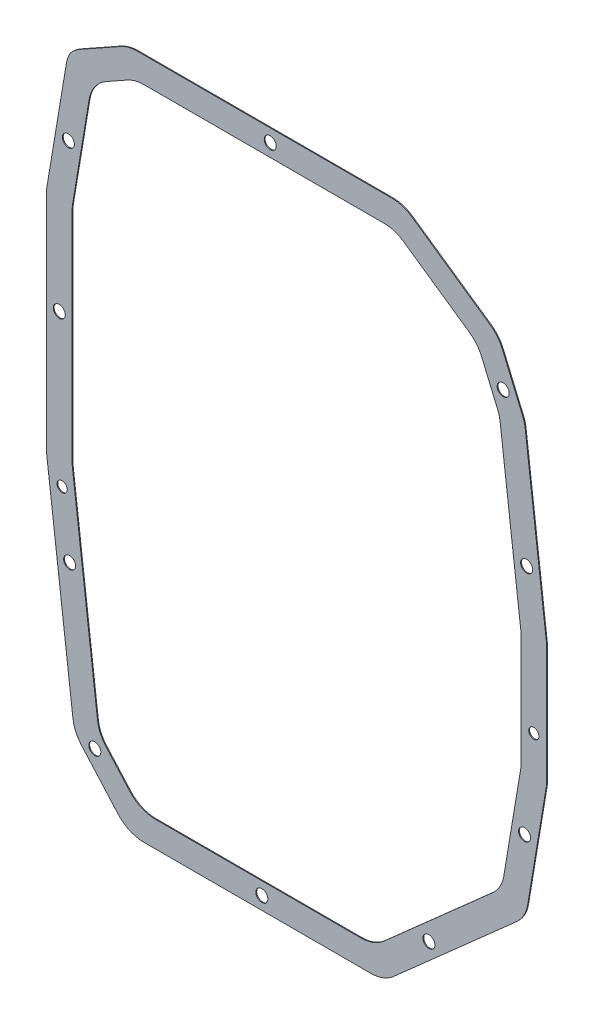
from build123d import *

# Parameters (mm, degrees)
ESTRUSIONE_ESTRUSIONE1_DEPTH         = 77
SCHIZZO2_R                           = 50
SCHIZZO2_R_2                         = 36
SCHIZZO2_R_3                         = 26
TAGLIO_ESTRUSIONE1_DEPTH             = 485.526998211
TAGLIO_ESTRUSIONE2_DEPTH             = 48
FORO_FILETTATO_M8_1_D                = 6.8
FORO_FILETTATO_M8_1_DEPTH            = 23
FORO_FILETTATO_M8_1_CSINK_D          = 8.05
FORO_FILETTATO_M8_1_CSINK_ANGLE      = 90
FORO_FILETTATO_M8_1_TIP              = 2.042926105
SCHIZZO10_R                          = 3.5
TAGLIO_ESTRUSIONE3_DEPTH             = 485.526998211
RACCORDO1_R                          = 20
RACCORDO2_R                          = 2
ESTRUSIONE_ESTRUSIONE2_START         = -4.5
SCHIZZO11_R                          = 50
SCHIZZO11_R_2                        = 43
ESTRUSIONE_ESTRUSIONE2_DEPTH         = 4.5
ESTRUSIONE_ESTRUSIONE4_START         = 5
SCHIZZO12_R                          = 33.5
ESTRUSIONE_ESTRUSIONE4_DEPTH         = 6
ESTRUSIONE_ESTRUSIONE5_START         = -4
SCHIZZO13_R                          = 26
SCHIZZO13_R_2                        = 23
ESTRUSIONE_ESTRUSIONE5_DEPTH         = 4
SCHIZZO15_R                          = 3
TAGLIO_ESTRUSIONE4_DEPTH             = 11
RACCORDO4_R                          = 20
FORO_FILETTATO_M20X1_5_1_D           = 18.5
FORO_FILETTATO_M20X1_5_1_DEPTH       = 44.5
FORO_FILETTATO_M20X1_5_1_CSINK_D     = 20.05
FORO_FILETTATO_M20X1_5_1_CSINK_ANGLE = 90
FORO_FILETTATO_M20X1_5_1_TIP         = 5.557960726
FORO_FILETTATO_G1_2_1_D              = 19
FORO_FILETTATO_G1_2_1_DEPTH          = 15
FORO_FILETTATO_G1_2_1_CSINK_D        = 21.005
FORO_FILETTATO_G1_2_1_CSINK_ANGLE    = 90
FORO_FILETTATO_M20X1_5_3_D           = 18.5
FORO_FILETTATO_M20X1_5_3_CSINK_D     = 20.05
FORO_FILETTATO_M20X1_5_3_CSINK_ANGLE = 90
RACCORDO6_R                          = 4
SCHIZZO24_W                          = 424.699843927
SCHIZZO24_H                          = 472.863672624
TAGLIO_ESTRUSIONE8_DEPTH             = 76.5


with BuildPart() as part:
    # Schizzo1 → Estrusione-Estrusione1 (new body)
    with BuildSketch(Plane.XY):
        Polygon((59.972038663, -9.548657155), (184.107415497, -9.548657155), (266.906928499, 63.824268584), (279.182675389, 137.377787042), (279.182675389, 207.628992193), (266.264112981, 313.83800459), (251.001397802, 349.730658864), (195.196318474, 388.451342845), (34.975107006, 388.451342845), (2.569160579, 370.255254654), (-0.4487972, 365.905709245), (-12.817324611, 291.796270746), (-12.817324611, 270.140647245), (-12.817324611, 159.542730711), (-8.096788353, 120.733188436), (-1.277749696, 64.670962751), (3.418345685, 26.062359347), (34.975107006, -9.548657155), align=None)
    extrude(amount=ESTRUSIONE_ESTRUSIONE1_DEPTH)

    # Schizzo2 → Taglio-Estrusione1 (cut, through all)
    with BuildSketch(Plane.XY.offset(77)):
        with Locations((119.182675389, 251.951342845)):
            Circle(SCHIZZO2_R)
        with Locations((227.185755277, 174.346140283)):
            Circle(SCHIZZO2_R_2)
        with Locations((119.182675389, 109.451342845)):
            Circle(SCHIZZO2_R_3)
    extrude(amount=-TAGLIO_ESTRUSIONE1_DEPTH, mode=Mode.SUBTRACT)

    # Schizzo4 → Taglio-Estrusione2 (cut)
    with BuildSketch(Plane(origin=(0, 0, 0), x_dir=(-1, 0, 0), z_dir=(0, 0, -1))):
        Polygon((-190.502060744, 373.451342845), (-238.892279388, 339.875503756), (-251.63003789, 309.920678761), (-264.182675389, 206.720091138), (-264.182675389, 138.620905818), (-252.98547965, 71.529823638), (-178.417565472, 5.451342845), (-41.724902169, 5.451342845), (-17.744303444, 32.512849195), (-2.182675389, 160.451631766), (-2.182675389, 290.55315197), (-13.652120373, 359.275490486), (-38.898311054, 373.451342845), align=None)
    extrude(amount=-TAGLIO_ESTRUSIONE2_DEPTH, mode=Mode.SUBTRACT)

    # Foro filettato M8-1
    with Locations(Plane(origin=(119.182675389, 309.951342845, 77), x_dir=(1, 0, 0), z_dir=(0, 0, 1))):
        with Locations((0, 0), (-50.22947342, -87), (50.229473419, -87), (63.003079888, -135.605202562), (130.503079888, -96.634059392), (130.503079888, -174.576345732), (0, -165.5), (-30.310889133, -218), (30.310889132, -218)):
            CounterSinkHole(FORO_FILETTATO_M8_1_D / 2, FORO_FILETTATO_M8_1_CSINK_D / 2, depth=FORO_FILETTATO_M8_1_DEPTH, counter_sink_angle=FORO_FILETTATO_M8_1_CSINK_ANGLE)
            with Locations((0, 0, -(FORO_FILETTATO_M8_1_DEPTH + FORO_FILETTATO_M8_1_TIP / 2))):  # 118° drill point
                Cone(0, FORO_FILETTATO_M8_1_D / 2, FORO_FILETTATO_M8_1_TIP, mode=Mode.SUBTRACT)

    # Schizzo10 → Taglio-Estrusione3 (cut, through all)
    with BuildSketch(Plane(origin=(0, 0, 0), x_dir=(-1, 0, 0), z_dir=(0, 0, -1))):
        with Locations((-117.807073551, 380.951342845)):
            Circle(SCHIZZO10_R)
        with Locations((-253.771981004, 324.049383053)):
            Circle(SCHIZZO10_R)
        with Locations((5.317324611, 234.131684501)):
            Circle(SCHIZZO10_R)
        with Locations((-266.254748996, 105.476430494)):
            Circle(SCHIZZO10_R)
        with Locations((-0.739238535, 110.203591991)):
            Circle(SCHIZZO10_R)
        with Locations((-112.919102804, -2.048657155)):
            Circle(SCHIZZO10_R)
        with Locations((0.002847066, 323.017867274)):
            Circle(SCHIZZO10_R)
        with Locations((-267.481177866, 241.716845092)):
            Circle(SCHIZZO10_R)
        with Locations((-210.419102804, 23.451342845)):
            Circle(SCHIZZO10_R)
        with Locations((-15.419102804, 23.451342845)):
            Circle(SCHIZZO10_R)
    extrude(amount=-TAGLIO_ESTRUSIONE3_DEPTH, mode=Mode.SUBTRACT)

    # Raccordo1
    # the kernel refuses this fillet: 20 mm, written as the material it takes off along each edge
    with BuildSketch(Plane(origin=(34.975107006, 388.451342845, -13.077346825), x_dir=(1, 0, 0), z_dir=(0, 0, 1))) as raccordo1_piece_1:
        with BuildLine():
            CenterArc((RACCORDO1_R * 0.261546936495, -RACCORDO1_R), RACCORDO1_R, 90, 29.314411212)
            Line((-RACCORDO1_R * 0.228054845331, -RACCORDO1_R * 0.128053846139), (0, 0))
            Line((0, 0), (RACCORDO1_R * 0.261546936495, 0))
        make_face()
    extrude(amount=103.15469365, mode=Mode.SUBTRACT)
    with BuildSketch(Plane(origin=(2.569160579, 370.255254654, -11.511478705), x_dir=(-0.5700695452044089, -0.821596442075085, 0), z_dir=(0, 0, 1))) as raccordo1_piece_2:
        with BuildLine():
            CenterArc((RACCORDO1_R * 0.230229574105, RACCORDO1_R), RACCORDO1_R, 244.069486706, 25.930513294)
            Line((-RACCORDO1_R * 0.207051218491, RACCORDO1_R * 0.100674970644), (0, 0))
            Line((0, 0), (RACCORDO1_R * 0.230229574105, 0))
        make_face()
    extrude(amount=100.022957411, mode=Mode.SUBTRACT)
    with BuildSketch(Plane(origin=(-0.4487972, 365.905709245, -11.212980636), x_dir=(-0.1646185376039717, -0.9863573070024523, 0), z_dir=(0, 0, 1))) as raccordo1_piece_3:
        with BuildLine():
            CenterArc((RACCORDO1_R * 0.224259612729, RACCORDO1_R), RACCORDO1_R, 244.719999772, 25.280000228)
            Line((-RACCORDO1_R * 0.202782643888, RACCORDO1_R * 0.0957683310879), (0, 0))
            Line((0, 0), (RACCORDO1_R * 0.224259612729, 0))
        make_face()
    extrude(amount=99.425961273, mode=Mode.SUBTRACT)
    with BuildSketch(Plane(origin=(-12.817324611, 291.796270746, -4.143729253), x_dir=(0, -1, 0), z_dir=(0, 0, 1))) as raccordo1_piece_4:
        with BuildLine():
            CenterArc((RACCORDO1_R * 0.0828745850626, RACCORDO1_R), RACCORDO1_R, 260.524924734, 9.475075266)
            Line((-RACCORDO1_R * 0.0817439525413, RACCORDO1_R * 0.0136426929975), (0, 0))
            Line((0, 0), (RACCORDO1_R * 0.0828745850626, 0))
        make_face()
    extrude(amount=85.287458506, mode=Mode.SUBTRACT)
    with BuildSketch(Plane(origin=(-12.817324611, 159.542730711, -3.029670184), x_dir=(0.12074349030746913, -0.9926837409509486, 0), z_dir=(0, 0, 1))) as raccordo1_piece_5:
        with BuildLine():
            CenterArc((RACCORDO1_R * 0.0605934036727, RACCORDO1_R), RACCORDO1_R, 263.064986553, 6.935013447)
            Line((-RACCORDO1_R * 0.0601500866348, RACCORDO1_R * 0.00731625904905), (0, 0))
            Line((0, 0), (RACCORDO1_R * 0.0605934036727, 0))
        make_face()
    extrude(amount=83.059340367, mode=Mode.SUBTRACT)
    with BuildSketch(Plane(origin=(3.418345685, 26.062359347, -15.578434173), x_dir=(0.6632186619985212, -0.7484256852733552, 0), z_dir=(0, 0, 1))) as raccordo1_piece_6:
        with BuildLine():
            CenterArc((RACCORDO1_R * 0.311568683461, RACCORDO1_R), RACCORDO1_R, 235.389202752, 34.610797248)
            Line((-RACCORDO1_R * 0.256430169524, RACCORDO1_R * 0.176970654832), (0, 0))
            Line((0, 0), (RACCORDO1_R * 0.311568683461, 0))
        make_face()
    extrude(amount=108.156868346, mode=Mode.SUBTRACT)
    with BuildSketch(Plane(origin=(34.975107006, -9.548657155, -22.499317209), x_dir=(1, 0, 0), z_dir=(0, 0, 1))) as raccordo1_piece_7:
        with BuildLine():
            CenterArc((RACCORDO1_R * 0.449986344173, RACCORDO1_R), RACCORDO1_R, 221.545810695, 48.454189305)
            Line((-RACCORDO1_R * 0.2984393411, RACCORDO1_R * 0.336781338001), (0, 0))
            Line((0, 0), (RACCORDO1_R * 0.449986344173, 0))
        make_face()
    extrude(amount=121.998634417, mode=Mode.SUBTRACT)
    with BuildSketch(Plane(origin=(184.107415497, -9.548657155, -18.966166752), x_dir=(-1, 0, 0), z_dir=(0, 0, 1))) as raccordo1_piece_8:
        with BuildLine():
            CenterArc((RACCORDO1_R * 0.379323335035, -RACCORDO1_R), RACCORDO1_R, 90, 41.545810695)
            Line((-RACCORDO1_R * 0.283895326964, -RACCORDO1_R * 0.251574314727), (0, 0))
            Line((0, 0), (RACCORDO1_R * 0.379323335035, 0))
        make_face()
    extrude(amount=114.932333503, mode=Mode.SUBTRACT)
    with BuildSketch(Plane(origin=(266.906928499, 63.824268584, -17.695673271), x_dir=(-0.7484256852733557, -0.6632186619985205, 0), z_dir=(0, 0, 1))) as raccordo1_piece_9:
        with BuildLine():
            CenterArc((RACCORDO1_R * 0.353913465424, -RACCORDO1_R), RACCORDO1_R, 90, 38.979114039)
            Line((-RACCORDO1_R * 0.275123591744, -RACCORDO1_R * 0.222624684782), (0, 0))
            Line((0, 0), (RACCORDO1_R * 0.353913465424, 0))
        make_face()
    extrude(amount=112.391346542, mode=Mode.SUBTRACT)
    with BuildSketch(Plane(origin=(279.182675389, 137.377787042, -4.143729253), x_dir=(-0.1646185376039625, -0.9863573070024537, 0), z_dir=(0, 0, 1))) as raccordo1_piece_10:
        with BuildLine():
            CenterArc((RACCORDO1_R * 0.0828745850626, -RACCORDO1_R), RACCORDO1_R, 90, 9.475075266)
            Line((-RACCORDO1_R * 0.0817439525413, -RACCORDO1_R * 0.0136426929975), (0, 0))
            Line((0, 0), (RACCORDO1_R * 0.0828745850626, 0))
        make_face()
    extrude(amount=85.287458506, mode=Mode.SUBTRACT)
    with BuildSketch(Plane(origin=(279.182675389, 207.628992193, -3.029670184), x_dir=(0, -1, 0), z_dir=(0, 0, 1))) as raccordo1_piece_11:
        with BuildLine():
            CenterArc((RACCORDO1_R * 0.0605934036727, -RACCORDO1_R), RACCORDO1_R, 90, 6.935013447)
            Line((-RACCORDO1_R * 0.0601500866348, -RACCORDO1_R * 0.00731625904905), (0, 0))
            Line((0, 0), (RACCORDO1_R * 0.0605934036727, 0))
        make_face()
    extrude(amount=83.059340367, mode=Mode.SUBTRACT)
    with BuildSketch(Plane(origin=(266.264112981, 313.83800459, -7.072321183), x_dir=(0.12074349030746688, -0.9926837409509489, 0), z_dir=(0, 0, 1))) as raccordo1_piece_12:
        with BuildLine():
            CenterArc((RACCORDO1_R * 0.141446423652, -RACCORDO1_R), RACCORDO1_R, 90, 16.101750132)
            Line((-RACCORDO1_R * 0.135897577057, -RACCORDO1_R * 0.0392293170219), (0, 0))
            Line((0, 0), (RACCORDO1_R * 0.141446423652, 0))
        make_face()
    extrude(amount=91.144642365, mode=Mode.SUBTRACT)
    with BuildSketch(Plane(origin=(251.001397802, 349.730658864, -14.435616051), x_dir=(0.39132168580287185, -0.9202539531131602, 0), z_dir=(0, 0, 1))) as raccordo1_piece_13:
        with BuildLine():
            CenterArc((RACCORDO1_R * 0.288712321022, -RACCORDO1_R), RACCORDO1_R, 90, 32.208160927)
            Line((-RACCORDO1_R * 0.244284477207, -RACCORDO1_R * 0.153882742714), (0, 0))
            Line((0, 0), (RACCORDO1_R * 0.288712321022, 0))
        make_face()
    extrude(amount=105.871232102, mode=Mode.SUBTRACT)
    with BuildSketch(Plane(origin=(195.196318474, 388.451342845, -15.647525765), x_dir=(0.8215964420750854, -0.570069545204408, 0), z_dir=(0, 0, 1))) as raccordo1_piece_14:
        with BuildLine():
            CenterArc((RACCORDO1_R * 0.312950515294, -RACCORDO1_R), RACCORDO1_R, 90, 34.755075494)
            Line((-RACCORDO1_R * 0.257119029911, -RACCORDO1_R * 0.178403557925), (0, 0))
            Line((0, 0), (RACCORDO1_R * 0.312950515294, 0))
        make_face()
    extrude(amount=108.295051529, mode=Mode.SUBTRACT)

    # Raccordo2
    # the kernel refuses this fillet: 2 mm, written as the material it takes off along each edge
    with BuildSketch(Plane(origin=(30.414010099, 385.890265922, 77), x_dir=(0.48960178182599706, -0.8719461538608957, 0), z_dir=(-0.8719461538608957, -0.48960178182599706, 0))) as raccordo2_piece_1:
        with BuildLine():
            CenterArc((RACCORDO2_R, -RACCORDO2_R), RACCORDO2_R, 90, 90)
            Line((0, -RACCORDO2_R), (0, 0))
            Line((0, 0), (RACCORDO2_R, 0))
        make_face()
    extrude(amount=27.329547338, mode=Mode.SUBTRACT)
    with BuildSketch(Plane(origin=(188.937308168, 388.451342845, 77), x_dir=(0, -1, 0), z_dir=(-1, 0, 0))) as raccordo2_piece_2:
        with BuildLine():
            CenterArc((RACCORDO2_R, -RACCORDO2_R), RACCORDO2_R, 90, 90)
            Line((0, -RACCORDO2_R), (0, 0))
            Line((0, 0), (RACCORDO2_R, 0))
        make_face()
    extrude(amount=148.731262432, mode=Mode.SUBTRACT)
    with BuildSketch(Plane(origin=(176.520948797, -9.548657155, 77), x_dir=(0, 0, -1), z_dir=(-1, 0, 0))) as raccordo2_piece_3:
        with BuildLine():
            CenterArc((RACCORDO2_R, -RACCORDO2_R), RACCORDO2_R, 90, 90)
            Line((0, -RACCORDO2_R), (0, 0))
            Line((0, 0), (RACCORDO2_R, 0))
        make_face()
    extrude(amount=132.546114907, mode=Mode.SUBTRACT)
    with BuildSketch(Plane(origin=(189.785322037, -4.517170861, 77), x_dir=(-0.663218661998521, 0.7484256852733554, 0), z_dir=(0.7484256852733554, 0.663218661998521, 0))) as raccordo2_piece_4:
        with BuildLine():
            CenterArc((RACCORDO2_R, -RACCORDO2_R), RACCORDO2_R, 90, 90)
            Line((0, -RACCORDO2_R), (0, 0))
            Line((0, 0), (RACCORDO2_R, 0))
        make_face()
    extrude(amount=95.966839884, mode=Mode.SUBTRACT)
    with BuildSketch(Plane(origin=(268.072142841, 70.805971237, 77), x_dir=(-0.9863573070024519, 0.16461853760397313, 0), z_dir=(0.16461853760397316, 0.986357307002452, 0))) as raccordo2_piece_5:
        with BuildLine():
            CenterArc((RACCORDO2_R, -RACCORDO2_R), RACCORDO2_R, 90, 90)
            Line((0, -RACCORDO2_R), (0, 0))
            Line((0, 0), (RACCORDO2_R, 0))
        make_face()
    extrude(amount=65.835104879, mode=Mode.SUBTRACT)
    with BuildSketch(Plane(origin=(279.182675389, 139.035278743, 77), x_dir=(-1, 0, 0), z_dir=(0, 1, 0))) as raccordo2_piece_6:
        with BuildLine():
            CenterArc((RACCORDO2_R, -RACCORDO2_R), RACCORDO2_R, 90, 90)
            Line((0, -RACCORDO2_R), (0, 0))
            Line((0, 0), (RACCORDO2_R, 0))
        make_face()
    extrude(amount=67.381845376, mode=Mode.SUBTRACT)
    with BuildSketch(Plane(origin=(279.036350208, 208.831993925, 77), x_dir=(-0.9926837409509485, -0.12074349030747052, 0), z_dir=(-0.12074349030747053, 0.9926837409509486, 0))) as raccordo2_piece_7:
        with BuildLine():
            CenterArc((RACCORDO2_R, -RACCORDO2_R), RACCORDO2_R, 90, 90)
            Line((0, -RACCORDO2_R), (0, 0))
            Line((0, 0), (RACCORDO2_R, 0))
        make_face()
    extrude(amount=102.950995518, mode=Mode.SUBTRACT)
    with BuildSketch(Plane(origin=(265.157091922, 316.441337201, 77), x_dir=(-0.9202539531131583, -0.3913216858028763, 0), z_dir=(-0.3913216858028763, 0.9202539531131584, 0))) as raccordo2_piece_8:
        with BuildLine():
            CenterArc((RACCORDO2_R, -RACCORDO2_R), RACCORDO2_R, 90, 90)
            Line((0, -RACCORDO2_R), (0, 0))
            Line((0, 0), (RACCORDO2_R, 0))
        make_face()
    extrude(amount=30.399813524, mode=Mode.SUBTRACT)
    with BuildSketch(Plane(origin=(246.257297487, 353.022380895, 77), x_dir=(-0.5700695452044079, -0.8215964420750858, 0), z_dir=(-0.8215964420750858, 0.5700695452044079, 0))) as raccordo2_piece_9:
        with BuildLine():
            CenterArc((RACCORDO2_R, -RACCORDO2_R), RACCORDO2_R, 90, 90)
            Line((0, -RACCORDO2_R), (0, 0))
            Line((0, 0), (RACCORDO2_R, 0))
        make_face()
    extrude(amount=55.889480606, mode=Mode.SUBTRACT)
    with BuildSketch(Plane(origin=(-1.18714299, 361.481707091, 77), x_dir=(0.9863573070024522, -0.16461853760397252, 0), z_dir=(-0.16461853760397252, -0.9863573070024522, 0))) as raccordo2_piece_10:
        with BuildLine():
            CenterArc((RACCORDO2_R, -RACCORDO2_R), RACCORDO2_R, 90, 90)
            Line((0, -RACCORDO2_R), (0, 0))
            Line((0, 0), (RACCORDO2_R, 0))
        make_face()
    extrude(amount=68.99179112, mode=Mode.SUBTRACT)
    with BuildSketch(Plane(origin=(-12.817324611, 160.754598785, 77), x_dir=(1, 0, 0), z_dir=(0, 1, 0))) as raccordo2_piece_11:
        with BuildLine():
            CenterArc((RACCORDO2_R, RACCORDO2_R), RACCORDO2_R, 180, 90)
            Line((0, RACCORDO2_R), (0, 0))
            Line((0, 0), (RACCORDO2_R, 0))
        make_face()
    extrude(amount=129.38418026, mode=Mode.SUBTRACT)
    with BuildSketch(Plane(origin=(2.665947879, 32.248142672, 77), x_dir=(0.9926837409509485, 0.12074349030747038, 0), z_dir=(-0.12074349030747038, 0.9926837409509485, 0))) as raccordo2_piece_12:
        with BuildLine():
            CenterArc((RACCORDO2_R, RACCORDO2_R), RACCORDO2_R, 180, 90)
            Line((0, RACCORDO2_R), (0, 0))
            Line((0, 0), (RACCORDO2_R, 0))
        make_face()
    extrude(amount=127.020904146, mode=Mode.SUBTRACT)
    with BuildSketch(Plane(origin=(7.551108992, 21.398639238, 77), x_dir=(0.7484256852733555, 0.6632186619985208, 0), z_dir=(0.6632186619985209, -0.7484256852733556, 0))) as raccordo2_piece_13:
        with BuildLine():
            CenterArc((RACCORDO2_R, -RACCORDO2_R), RACCORDO2_R, 90, 90)
            Line((0, -RACCORDO2_R), (0, 0))
            Line((0, 0), (RACCORDO2_R, 0))
        make_face()
    extrude(amount=32.350131897, mode=Mode.SUBTRACT)
    with BuildSketch(Plane(origin=(188.937308168, 368.451342845, 77), x_dir=(0, 1, 0), z_dir=(-1, 0, 0))) as raccordo2_piece_14:
        with BuildLine():
            CenterArc((20 - RACCORDO2_R, RACCORDO2_R), RACCORDO2_R, 270, 90)
            Line((20, RACCORDO2_R), (20, 0))
            Line((20, 0), (20 - RACCORDO2_R, 0))
        make_face()
    revolve(axis=Axis((188.937308168, 368.451342845, 77), (0, 0, -1)), revolution_arc=34.755075494, mode=Mode.SUBTRACT)
    with BuildSketch(Plane(origin=(234.855906583, 336.590452054, 77), x_dir=(0.570069545204261, 0.8215964420751876, 0), z_dir=(-0.8215964420751876, 0.570069545204261, 0))) as raccordo2_piece_15:
        with BuildLine():
            CenterArc((20 - RACCORDO2_R, RACCORDO2_R), RACCORDO2_R, 270, 90)
            Line((20, RACCORDO2_R), (20, 0))
            Line((20, 0), (20 - RACCORDO2_R, 0))
        make_face()
    revolve(axis=Axis((234.855906583, 336.590452054, 77), (0, 0, -1)), revolution_arc=32.208160927, mode=Mode.SUBTRACT)
    with BuildSketch(Plane(origin=(246.752012859, 308.614903485, 77), x_dir=(0.9202539531133431, 0.39132168580244153, 0), z_dir=(-0.39132168580244153, 0.9202539531133431, 0))) as raccordo2_piece_16:
        with BuildLine():
            CenterArc((20 - RACCORDO2_R, RACCORDO2_R), RACCORDO2_R, 270, 90)
            Line((20, RACCORDO2_R), (20, 0))
            Line((20, 0), (20 - RACCORDO2_R, 0))
        make_face()
    revolve(axis=Axis((246.752012859, 308.614903485, 77), (0, 0, -1)), revolution_arc=16.101750132, mode=Mode.SUBTRACT)
    with BuildSketch(Plane(origin=(259.182675389, 206.417124119, 77), x_dir=(0.9926837409509487, 0.12074349030746842, 0), z_dir=(-0.12074349030746842, 0.9926837409509487, 0))) as raccordo2_piece_17:
        with BuildLine():
            CenterArc((20 - RACCORDO2_R, RACCORDO2_R), RACCORDO2_R, 270, 90)
            Line((20, RACCORDO2_R), (20, 0))
            Line((20, 0), (20 - RACCORDO2_R, 0))
        make_face()
    revolve(axis=Axis((259.182675389, 206.417124119, 77), (0, 0, -1)), revolution_arc=6.935013447, mode=Mode.SUBTRACT)
    with BuildSketch(Plane(origin=(259.182675389, 139.035278743, 77), x_dir=(1, 0, 0), z_dir=(0, 1, 0))) as raccordo2_piece_18:
        with BuildLine():
            CenterArc((20 - RACCORDO2_R, RACCORDO2_R), RACCORDO2_R, 270, 90)
            Line((20, RACCORDO2_R), (20, 0))
            Line((20, 0), (20 - RACCORDO2_R, 0))
        make_face()
    revolve(axis=Axis((259.182675389, 139.035278743, 77), (0, 0, -1)), revolution_arc=9.475075266, mode=Mode.SUBTRACT)
    with BuildSketch(Plane(origin=(248.344996701, 74.098341989, 77), x_dir=(0.9863573070025499, -0.16461853760338632, 0), z_dir=(0.16461853760338632, 0.9863573070025499, 0))) as raccordo2_piece_19:
        with BuildLine():
            CenterArc((20 - RACCORDO2_R, RACCORDO2_R), RACCORDO2_R, 270, 90)
            Line((20, RACCORDO2_R), (20, 0))
            Line((20, 0), (20 - RACCORDO2_R, 0))
        make_face()
    revolve(axis=Axis((248.344996701, 74.098341989, 77), (0, 0, -1)), revolution_arc=38.979114039, mode=Mode.SUBTRACT)
    with BuildSketch(Plane(origin=(176.520948797, 10.451342845, 77), x_dir=(0.6632186619985235, -0.7484256852733531, 0), z_dir=(0.7484256852733531, 0.6632186619985235, 0))) as raccordo2_piece_20:
        with BuildLine():
            CenterArc((20 - RACCORDO2_R, RACCORDO2_R), RACCORDO2_R, 270, 90)
            Line((20 - RACCORDO2_R, 0), (20, 0))
            Line((20, 0), (20, RACCORDO2_R))
        make_face()
    revolve(axis=Axis((176.520948797, 10.451342845, 77), (0, 0, -1)), revolution_arc=41.545810695, mode=Mode.SUBTRACT)
    with BuildSketch(Plane(origin=(43.97483389, 10.451342845, 77), x_dir=(0, -1, 0), z_dir=(1, 0, 0))) as raccordo2_piece_21:
        with BuildLine():
            CenterArc((20 - RACCORDO2_R, RACCORDO2_R), RACCORDO2_R, 270, 90)
            Line((20, RACCORDO2_R), (20, 0))
            Line((20, 0), (20 - RACCORDO2_R, 0))
        make_face()
    revolve(axis=Axis((43.97483389, 10.451342845, 77), (0, 0, -1)), revolution_arc=48.454189305, mode=Mode.SUBTRACT)
    with BuildSketch(Plane(origin=(22.519622698, 34.663012478, 77), x_dir=(-0.7484256852729614, -0.6632186619989657, 0), z_dir=(0.6632186619989657, -0.7484256852729614, 0))) as raccordo2_piece_22:
        with BuildLine():
            CenterArc((20 - RACCORDO2_R, RACCORDO2_R), RACCORDO2_R, 270, 90)
            Line((20, RACCORDO2_R), (20, 0))
            Line((20, 0), (20 - RACCORDO2_R, 0))
        make_face()
    revolve(axis=Axis((22.519622698, 34.663012478, 77), (0, 0, -1)), revolution_arc=34.610797248, mode=Mode.SUBTRACT)
    with BuildSketch(Plane(origin=(7.182675389, 160.754598785, 77), x_dir=(-0.9926837409510056, -0.1207434903070009, 0), z_dir=(0.1207434903070009, -0.9926837409510056, 0))) as raccordo2_piece_23:
        with BuildLine():
            CenterArc((20 - RACCORDO2_R, RACCORDO2_R), RACCORDO2_R, 270, 90)
            Line((20, RACCORDO2_R), (20, 0))
            Line((20, 0), (20 - RACCORDO2_R, 0))
        make_face()
    revolve(axis=Axis((7.182675389, 160.754598785, 77), (0, 0, -1)), revolution_arc=6.935013447, mode=Mode.SUBTRACT)
    with BuildSketch(Plane(origin=(7.182675389, 290.138779045, 77), x_dir=(-1, 0, 0), z_dir=(0, -1, 0))) as raccordo2_piece_24:
        with BuildLine():
            CenterArc((20 - RACCORDO2_R, RACCORDO2_R), RACCORDO2_R, 270, 90)
            Line((20, RACCORDO2_R), (20, 0))
            Line((20, 0), (20 - RACCORDO2_R, 0))
        make_face()
    revolve(axis=Axis((7.182675389, 290.138779045, 77), (0, 0, -1)), revolution_arc=9.475075266, mode=Mode.SUBTRACT)
    with BuildSketch(Plane(origin=(18.54000315, 358.189336339, 77), x_dir=(-0.9863573070024353, 0.16461853760407336, 0), z_dir=(-0.16461853760407336, -0.9863573070024353, 0))) as raccordo2_piece_25:
        with BuildLine():
            CenterArc((20 - RACCORDO2_R, RACCORDO2_R), RACCORDO2_R, 270, 90)
            Line((20, RACCORDO2_R), (20, 0))
            Line((20, 0), (20 - RACCORDO2_R, 0))
        make_face()
    revolve(axis=Axis((18.54000315, 358.189336339, 77), (0, 0, -1)), revolution_arc=34.158995702, mode=Mode.SUBTRACT)
    with BuildSketch(Plane(origin=(16.376152048, 355.070747771, 77), x_dir=(-0.8997401995027494, 0.4364259082579227, 0), z_dir=(-0.4364259082579227, -0.8997401995027494, 0))) as raccordo2_piece_26:
        with BuildLine():
            CenterArc((20 - RACCORDO2_R, RACCORDO2_R), RACCORDO2_R, 270, 90)
            Line((20, RACCORDO2_R), (20, 0))
            Line((20, 0), (20 - RACCORDO2_R, 0))
        make_face()
    revolve(axis=Axis((16.376152048, 355.070747771, 77), (0, 0, -1)), revolution_arc=34.809527395, mode=Mode.SUBTRACT)
    with BuildSketch(Plane(origin=(40.206045736, 368.451342845, 77), x_dir=(-0.4896017818259922, 0.8719461538608984, 0), z_dir=(-0.8719461538608984, -0.4896017818259922, 0))) as raccordo2_piece_27:
        with BuildLine():
            CenterArc((20 - RACCORDO2_R, RACCORDO2_R), RACCORDO2_R, 270, 90)
            Line((20, RACCORDO2_R), (20, 0))
            Line((20, 0), (20 - RACCORDO2_R, 0))
        make_face()
    revolve(axis=Axis((40.206045736, 368.451342845, 77), (0, 0, -1)), revolution_arc=29.314411212, mode=Mode.SUBTRACT)

    # Schizzo11 → Estrusione-Estrusione2 (add)
    with BuildSketch(Plane(origin=(0, 0, 48), x_dir=(-1, 0, 0), z_dir=(0, 0, -1)).offset(ESTRUSIONE_ESTRUSIONE2_START)):
        with Locations(Location((-119.182675389, 251.951342845, 0), (0, 0, 180))):
            Circle(SCHIZZO11_R)
        with Locations((-119.182675389, 251.951342845)):
            Circle(SCHIZZO11_R_2, mode=Mode.SUBTRACT)
    extrude(amount=ESTRUSIONE_ESTRUSIONE2_DEPTH)

    # Schizzo12 → Estrusione-Estrusione4 (add)
    with BuildSketch(Plane(origin=(0, 0, 48), x_dir=(-1, 0, 0), z_dir=(0, 0, -1)).offset(ESTRUSIONE_ESTRUSIONE4_START)):
        with BuildLine():
            Line((-267.185755277, 219.346140283), (-227.185755277, 219.346140283))
            ThreePointArc((-227.185755277, 219.346140283), (-182.185755277, 174.346140283), (-227.185755277, 129.346140283))
            Line((-227.185755277, 129.346140283), (-267.185755277, 129.346140283))
            Line((-267.185755277, 129.346140283), (-265.474250546, 179.346140283))
            Line((-265.474250546, 179.346140283), (-267.185755277, 219.346140283))
        make_face()
        with Locations((-227.185755277, 174.346140283)):
            Circle(SCHIZZO12_R, mode=Mode.SUBTRACT)
    extrude(amount=-ESTRUSIONE_ESTRUSIONE4_DEPTH)

    # Schizzo13 → Estrusione-Estrusione5 (add)
    with BuildSketch(Plane(origin=(0, 0, 48), x_dir=(-1, 0, 0), z_dir=(0, 0, -1)).offset(ESTRUSIONE_ESTRUSIONE5_START)):
        with Locations(Location((-119.182675389, 109.451342845, 0), (0, 0, 180))):
            Circle(SCHIZZO13_R)
        with Locations((-119.182675389, 109.451342845)):
            Circle(SCHIZZO13_R_2, mode=Mode.SUBTRACT)
    extrude(amount=ESTRUSIONE_ESTRUSIONE5_DEPTH)

    # Schizzo15 → Taglio-Estrusione4 (cut)
    with BuildSketch(Plane(origin=(0, 0, 0), x_dir=(-1, 0, 0), z_dir=(0, 0, -1))):
        with Locations((-271.682675389, 159.346140283)):
            Circle(SCHIZZO15_R)
        with Locations((3.656902199, 146.346140283)):
            Circle(SCHIZZO15_R)
    extrude(amount=-TAGLIO_ESTRUSIONE4_DEPTH, mode=Mode.SUBTRACT)

    # Raccordo4
    raccordo4_edges = [part.edges().sort_by_distance(p)[0] for p in [
        (264.182675389, 206.720091138, 21.5),
        (264.182675389, 138.620905818, 21.5),
        (38.898311054, 373.451342845, 24),
        (13.652120373, 359.275490486, 24),
        (2.182675389, 290.55315197, 24),
        (2.182675389, 160.451631766, 24),
        (17.744303444, 32.512849195, 24),
        (41.724902169, 5.451342845, 24),
        (178.417565472, 5.451342845, 24),
        (252.98547965, 71.529823638, 24),
        (251.63003789, 309.920678761, 24),
        (238.892279388, 339.875503756, 24),
        (190.502060744, 373.451342845, 24),
    ]]
    fillet(raccordo4_edges, radius=RACCORDO4_R)

    # Foro filettato M20x1.5-1
    with Locations(Plane(origin=(60, 388.451342845, 30), x_dir=(1, 0, 0), z_dir=(0, 1, 0))):
        with Locations((0, 0)):
            CounterSinkHole(FORO_FILETTATO_M20X1_5_1_D / 2, FORO_FILETTATO_M20X1_5_1_CSINK_D / 2, depth=FORO_FILETTATO_M20X1_5_1_DEPTH, counter_sink_angle=FORO_FILETTATO_M20X1_5_1_CSINK_ANGLE)
            with Locations((0, 0, -(FORO_FILETTATO_M20X1_5_1_DEPTH + FORO_FILETTATO_M20X1_5_1_TIP / 2))):  # 118° drill point
                Cone(0, FORO_FILETTATO_M20X1_5_1_D / 2, FORO_FILETTATO_M20X1_5_1_TIP, mode=Mode.SUBTRACT)

    # Foro filettato G1/2-1
    with Locations(Plane(origin=(-0.956356831, 62.0286549, 30), x_dir=(0.120743490307, -0.992683740951, 0), z_dir=(-0.992683740951, -0.120743490307, 0))):
        with Locations((0, 0)):
            CounterSinkHole(FORO_FILETTATO_G1_2_1_D / 2, FORO_FILETTATO_G1_2_1_CSINK_D / 2, depth=FORO_FILETTATO_G1_2_1_DEPTH, counter_sink_angle=FORO_FILETTATO_G1_2_1_CSINK_ANGLE)

    # Foro filettato M20x1.5-3 (through all)
    with Locations(Plane(origin=(60, -9.548657155, 30), x_dir=(0, 0, -1), z_dir=(0, -1, 0))):
        with Locations((0, 0)):
            CounterSinkHole(FORO_FILETTATO_M20X1_5_3_D / 2, FORO_FILETTATO_M20X1_5_3_CSINK_D / 2, counter_sink_angle=FORO_FILETTATO_M20X1_5_3_CSINK_ANGLE)

    # Raccordo6
    raccordo6_edges = [part.edges().sort_by_distance(p)[0] for p in [
        (258.392726649, 103.928833287, 48),
        (215.891696552, 38.659106238, 48),
        (110.777863912, 5.451342845, 48),
        (28.816591049, 20.018049346, 48),
        (9.660453104, 98.973631277, 48),
        (2.182675389, 225.279580054, 48),
        (7.26491922, 321.004815623, 48),
        (28.17331692, 367.429209236, 48),
        (114.186150111, 373.451342845, 48),
        (214.896310208, 356.525248737, 48),
        (245.837442031, 323.542871017, 48),
        (257.309269397, 263.229293872, 48),
        (238.258720659, 339.359874184, 48),
        (251.437728609, 309.869200406, 48),
        (190.216383812, 372.538492669, 48),
        (39.068541411, 372.800483155, 48),
        (15.434514295, 358.023716898, 48),
        (2.251005579, 290.547489134, 48),
        (2.2192902, 160.453850382, 48),
        (18.608965239, 32.902176891, 48),
        (42.517542626, 7.212819538, 48),
        (177.924395815, 6.75147287, 48),
        (251.921923958, 72.118504243, 48),
    ]]
    fillet(raccordo6_edges, radius=RACCORDO6_R)

    # Schizzo24 → Taglio-Estrusione8 (cut)
    with BuildSketch(Plane.XY.offset(77)):
        with Locations((136.251620643, 185.923071566)):
            Rectangle(SCHIZZO24_W, SCHIZZO24_H)
    extrude(amount=-TAGLIO_ESTRUSIONE8_DEPTH, mode=Mode.SUBTRACT)


solid = part.part
